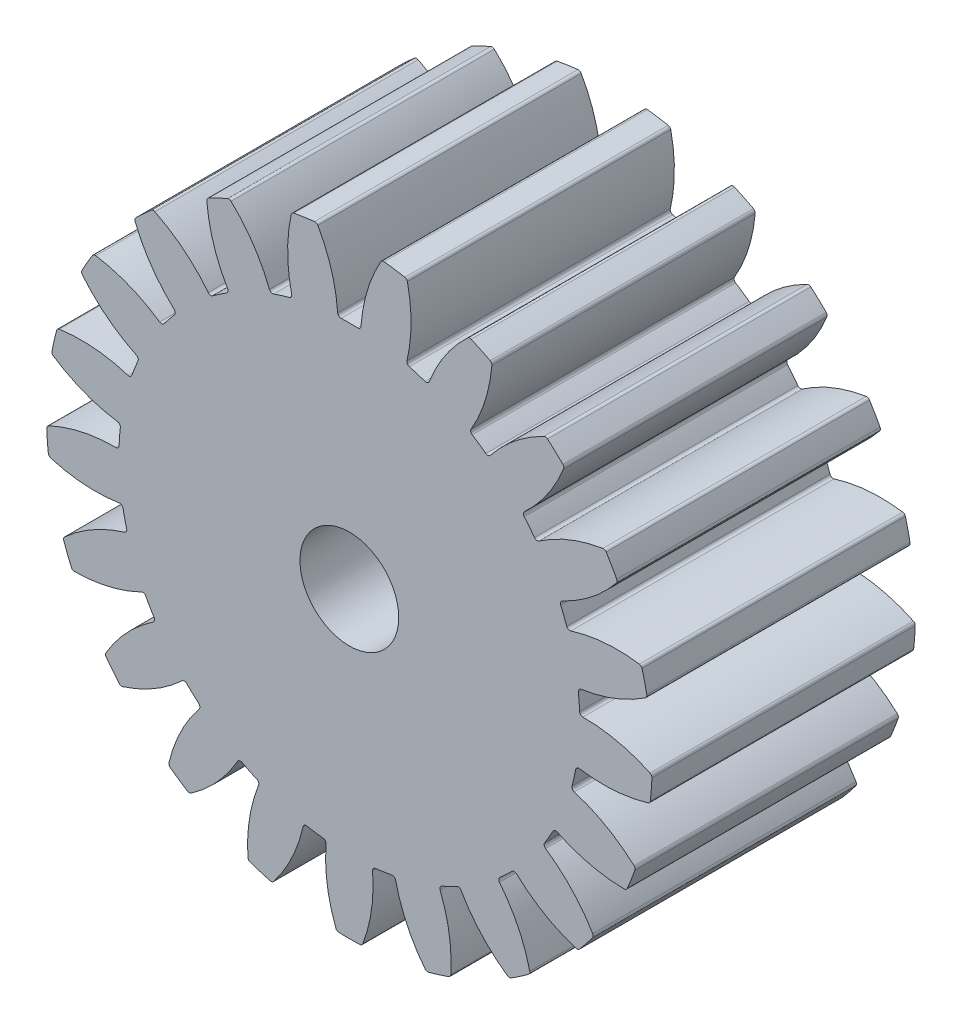
from build123d import *

# Parameters (mm, degrees)
SKETCH_1_R                       = 9.2
SKETCH_1_R_2                     = 1.5
EXTRUDE_1_DEPTH                  = 4
CUT_EXTRUDE_1_DEPTH              = 14.611759622
FILLET_1_R                       = 0.1
PATTERN_CIRCULAR_1_COUNT         = 21
FILLET_1_OF_PATTERN_CIRCULAR_1_R = 0.1


with BuildPart() as part:
    # Эскиз1 → Бобышка-Вытянуть1 (new, symmetric)
    with BuildSketch(Plane.XY):
        Circle(SKETCH_1_R)
        Circle(SKETCH_1_R_2, mode=Mode.SUBTRACT)
    extrude(amount=EXTRUDE_1_DEPTH, both=True)

    # Эскиз2 → Вырез-Вытянуть1 (cut, symmetric)
    with BuildSketch(Plane.XY):
        with BuildLine():
            ThreePointArc((0.347829417, 6.991352852), (0, 7), (-0.347829417, 6.991352852))
            ThreePointArc((-0.347829417, 6.991352852), (-0.53886683, 8.107609048), (-0.989326685, 9.146651448))
            ThreePointArc((-0.989326685, 9.146651448), (0, 9.2), (0.989326685, 9.146651448))
            ThreePointArc((0.989326685, 9.146651448), (0.53886683, 8.107609048), (0.347829417, 6.991352852))
        make_face()
    cut_extrude_1 = extrude(amount=CUT_EXTRUDE_1_DEPTH, both=True, mode=Mode.SUBTRACT)

    # Скругление1
    fillet_1_edges = [part.edges().sort_by_distance(p)[0] for p in [
        (0.989326685, 9.146651448, 0),
        (0.347829417, 6.991352852, 0),
        (-0.347829417, 6.991352852, 0),
        (-0.989326685, 9.146651448, 0),
    ]]
    fillet(fillet_1_edges, radius=FILLET_1_R)

    # Круговой массив1: Вырез-Вытянуть1 ×21 about axis
    pattern_circular_1_axis = Axis((0, 0, 4), (0, 0, -1))
    for i in range(1, PATTERN_CIRCULAR_1_COUNT):
        add(cut_extrude_1.rotate(pattern_circular_1_axis, i * 360 / PATTERN_CIRCULAR_1_COUNT), mode=Mode.SUBTRACT)

    # Скругление1 of Круговой массив1
    fillet_1_of_pattern_circular_1_edges = [part.edges().sort_by_distance(p)[0] for p in [
        (3.641396519, 8.448682228, 0),
        (2.393113761, 6.57822214, 0),
        (1.728361097, 6.783271181, 0),
        (1.750649166, 9.031900547, 0),
        (5.969912293, 7.000010516, 0),
        (4.225759446, 5.580587523, 0),
        (3.650979143, 5.972466098, 0),
        (4.335072157, 8.114625647, 0),
        (7.76797516, 4.92935715, 0),
        (5.682927859, 4.087093215, 0),
        (5.24919167, 4.630981193, 0),
        (6.534304962, 6.476330648, 0),
        (8.875819346, 2.420708769, 0),
        (6.635143193, 2.230442739, 0),
        (6.380990482, 2.878013286, 0),
        (8.152936096, 4.26258525, 0),
        (9.195008031, -0.303030209, 0),
        (6.997796936, 0.175607637, 0),
        (6.945810286, 0.869321269, 0),
        (9.04714308, 1.670090446, 0),
        (8.697179902, -2.999843623, 0),
        (6.738665712, -1.894830974, 0),
        (6.893464366, -1.216613759, 0),
        (9.137471698, -1.070799223, 0),
        (7.426569171, -5.430107766, 0),
        (5.880774468, -3.796905537, 0),
        (6.228603885, -3.194447314, 0),
        (8.415895856, -3.716543682, 0),
        (5.496075178, -7.377883005, 0),
        (4.500350604, -5.361608382, 0),
        (5.010304615, -4.888440208, 0),
        (6.946530735, -6.032056925, 0),
        (3.077230787, -8.670100962, 0),
        (2.72005084, -6.449908792, 0),
        (3.346817793, -6.148073736, 0),
        (4.859935874, -7.811595439, 0),
        (0.384960936, -9.1919424, 0),
        (0.698062623, -6.965106501, 0),
        (1.385951523, -6.861423932, 0),
        (2.341514383, -8.897039417, 0),
        (-2.341514383, -8.897039417, 0),
        (-1.385951523, -6.861423932, 0),
        (-0.698062623, -6.965106501, 0),
        (-0.384960936, -9.1919424, 0),
        (-4.859935874, -7.811595439, 0),
        (-3.346817793, -6.148073736, 0),
        (-2.72005084, -6.449908792, 0),
        (-3.077230787, -8.670100962, 0),
        (-6.946530735, -6.032056925, 0),
        (-5.010304615, -4.888440208, 0),
        (-4.500350604, -5.361608382, 0),
        (-5.496075178, -7.377883005, 0),
        (-8.415895856, -3.716543682, 0),
        (-6.228603885, -3.194447314, 0),
        (-5.880774468, -3.796905537, 0),
        (-7.426569171, -5.430107766, 0),
        (-9.137471698, -1.070799223, 0),
        (-6.893464366, -1.216613759, 0),
        (-6.738665712, -1.894830974, 0),
        (-8.697179902, -2.999843623, 0),
        (-9.04714308, 1.670090446, 0),
        (-6.945810286, 0.869321269, 0),
        (-6.997796936, 0.175607637, 0),
        (-9.195008031, -0.303030209, 0),
        (-8.152936096, 4.26258525, 0),
        (-6.380990482, 2.878013286, 0),
        (-6.635143193, 2.230442739, 0),
        (-8.875819346, 2.420708769, 0),
        (-6.534304962, 6.476330648, 0),
        (-5.24919167, 4.630981193, 0),
        (-5.682927859, 4.087093215, 0),
        (-7.76797516, 4.92935715, 0),
        (-4.335072157, 8.114625647, 0),
        (-3.650979143, 5.972466098, 0),
        (-4.225759446, 5.580587523, 0),
        (-5.969912293, 7.000010516, 0),
        (-1.750649166, 9.031900547, 0),
        (-1.728361097, 6.783271181, 0),
        (-2.393113761, 6.57822214, 0),
        (-3.641396519, 8.448682228, 0),
    ]]
    fillet(fillet_1_of_pattern_circular_1_edges, radius=FILLET_1_OF_PATTERN_CIRCULAR_1_R)


solid = part.part
